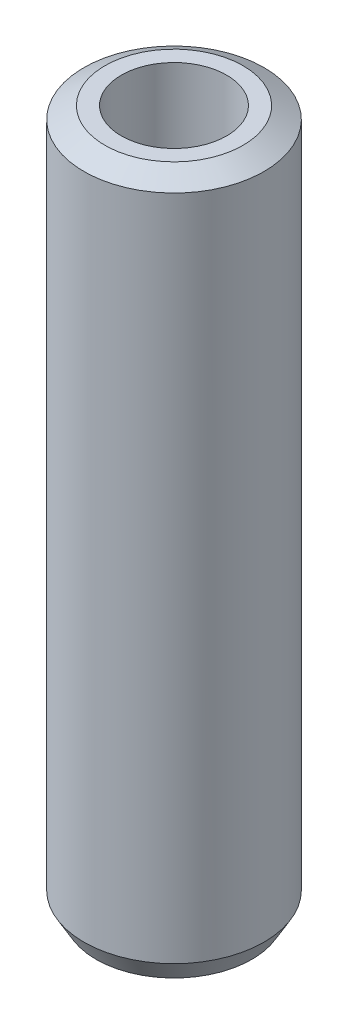
from build123d import *
from OCP.BRepFilletAPI import BRepFilletAPI_MakeChamfer

# Parameters (mm, degrees)
SKETCH1_R           = 30
BOSS_EXTRUDE1_DEPTH = 233.35407319
SKETCH2_R           = 17.548051587
CUT_EXTRUDE1_DEPTH  = 238.1795174
CHAMFER1_SIZE       = 4.04315109
CHAMFER1_SIZE2      = 7.002943111


with BuildPart() as part:
    # Sketch1 → Boss-Extrude1 (new body)
    with BuildSketch(Plane(origin=(0, 0, 0), x_dir=(1, 0, 0), z_dir=(0, 1, 0))):
        Circle(SKETCH1_R)
    extrude(amount=BOSS_EXTRUDE1_DEPTH)

    # Sketch2 → Cut-Extrude1 (cut, through all)
    with BuildSketch(Plane(origin=(0, 0, 0), x_dir=(1, 0, 0), z_dir=(0, 1, 0))):
        Circle(SKETCH2_R)
    extrude(amount=CUT_EXTRUDE1_DEPTH, mode=Mode.SUBTRACT)

    # Chamfer1: one chamfer whose edges measure the first distance from different faces: ONE call of the kernel's chamfer builder (chamfer() names one face for all edges)
    chamfer1_edges_1 = [part.edges().sort_by_distance(p)[0] for p in [
        (-30, 233.35407319, 0),
    ]]
    chamfer1_side_1 = [part.faces().sort_by_distance(p)[0] for p in [
        (-30, 116.677036595, 0),
    ]]
    chamfer1_edges_2 = [part.edges().sort_by_distance(p)[0] for p in [
        (-30, 0, 0),
    ]]
    chamfer1_side_2 = [part.faces().sort_by_distance(p)[0] for p in [
        (-29.151471863, 0, 0),
    ]]
    chamfer1 = BRepFilletAPI_MakeChamfer(part.part.solid().wrapped)
    for e in chamfer1_edges_1:
        chamfer1.Add(CHAMFER1_SIZE, CHAMFER1_SIZE2, e.wrapped, chamfer1_side_1[0].wrapped)  # the first distance lies on this face
    for e in chamfer1_edges_2:
        chamfer1.Add(CHAMFER1_SIZE, CHAMFER1_SIZE2, e.wrapped, chamfer1_side_2[0].wrapped)  # the first distance lies on this face
    add(Compound.cast(chamfer1.Shape()), mode=Mode.REPLACE)


solid = part.part
